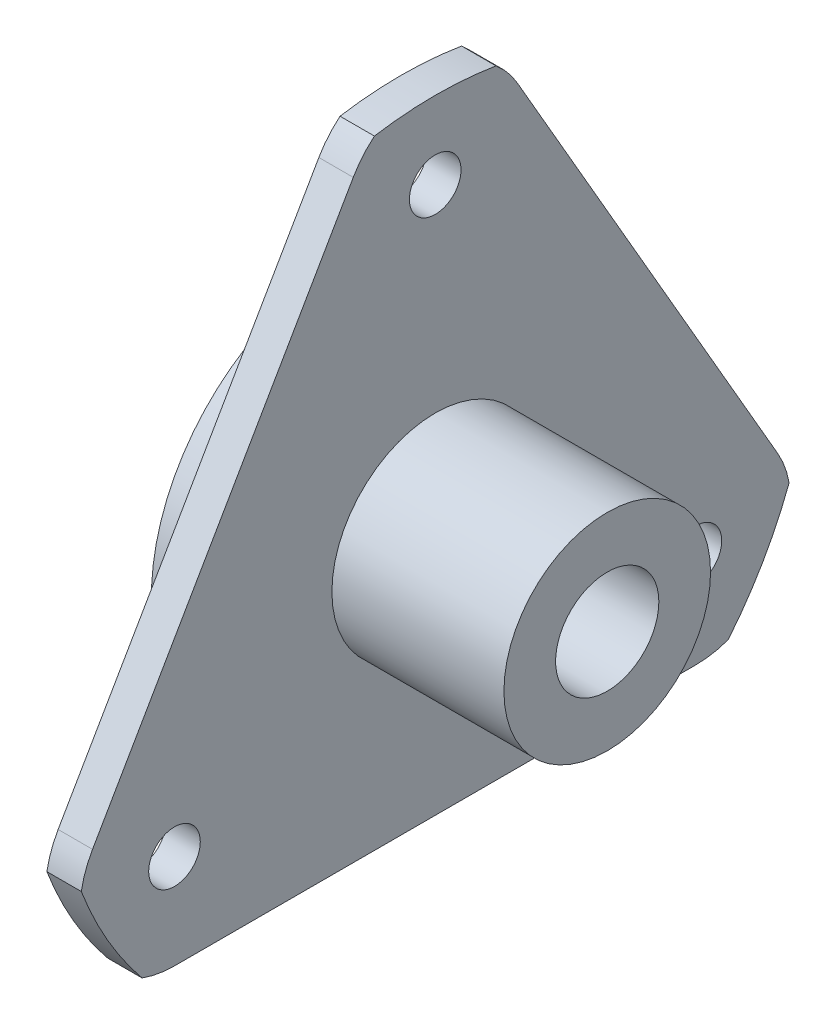
from build123d import *

# Parameters (mm, degrees)
SZKIC3_R                   = 52.402959686
SZKIC3_R_2                 = 3
WYTNIJ_WYCI_GNI_CIE1_DEPTH = 67.693328002


with BuildPart() as part:
    # Szkic2 → Obrót1 (revolve)
    with BuildSketch(Plane.XY):
        Polygon((0, 6), (-30, 6), (-30, 23), (-24, 23), (-24, 44), (-20, 44), (-20, 12.010834691), (0, 12.010834691), align=None)
    revolve(axis=Axis((0, 0, 0), (-1, 0, 0)))

    # Szkic3 → Wytnij-wyciągnięcie1 (cut, through all)
    # profile 1 of 4: a face of its own
    with BuildSketch(Plane.ZY.offset(24)):
        Circle(SZKIC3_R)
        with BuildLine():
            Line((-39.837168574, -12), (-9.526279442, 40.5))
            ThreePointArc((-9.526279442, 40.5), (0, 46), (9.526279442, 40.5))
            Line((9.526279442, 40.5), (39.837168574, -12))
            ThreePointArc((39.837168574, -12), (39.837168574, -23), (30.310889132, -28.5))
            Line((30.310889132, -28.5), (-30.310889132, -28.5))
            ThreePointArc((-30.310889132, -28.5), (-39.837168574, -23), (-39.837168574, -12))
        make_face(mode=Mode.SUBTRACT)
    # profile 2 of 4: a face of its own
    with BuildSketch(Plane.ZY.offset(24)):
        with Locations((0, 35)):
            Circle(SZKIC3_R_2)
    # profile 3 of 4: a face of its own
    with BuildSketch(Plane.ZY.offset(24)):
        with Locations((30.310889132, -17.5)):
            Circle(SZKIC3_R_2)
    # profile 4 of 4: a face of its own
    with BuildSketch(Plane.ZY.offset(24)):
        with Locations((-30.310889132, -17.5)):
            Circle(SZKIC3_R_2)
    extrude(amount=-WYTNIJ_WYCI_GNI_CIE1_DEPTH, mode=Mode.SUBTRACT)


solid = part.part
